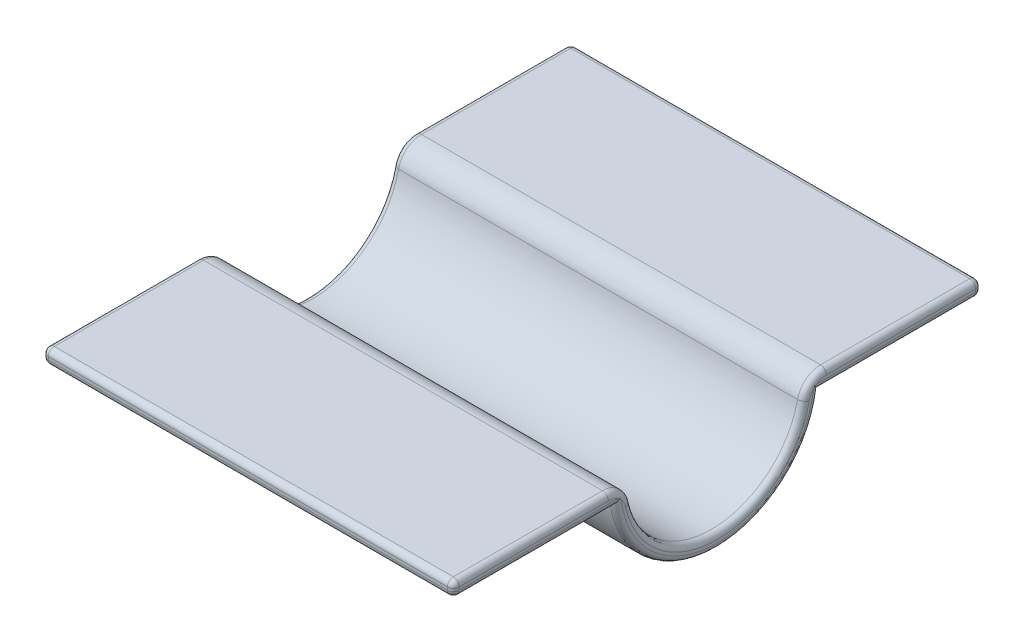
from build123d import *

# Parameters (mm, degrees)
BOSS_EXTRUDE1_DEPTH = 70
FILLET1_R           = 1
FILLET2_R           = 4
FILLET3_R           = 1


with BuildPart() as part:
    # Sketch1 → Boss-Extrude1 (new body)
    with BuildSketch(Plane(origin=(0, 0, 0), x_dir=(0, 0, -1), z_dir=(1, 0, 0))):
        with BuildLine():
            Line((-45, 0), (-15, 0))
            ThreePointArc((-15, 0), (0, -15), (15, 0))
            Line((15, 0), (45, 0))
            Line((45, 0), (45, -2.5))
            Line((45, -2.5), (17.320508076, -2.5))
            ThreePointArc((17.320508076, -2.5), (0, -17.5), (-17.320508076, -2.5))
            Line((-17.320508076, -2.5), (-45, -2.5))
            Line((-45, -2.5), (-45, 0))
        make_face()
    extrude(amount=BOSS_EXTRUDE1_DEPTH)

    # Fillet1
    fillet1_edges = [part.edges().sort_by_distance(p)[0] for p in [
        (35, 0, -45),
        (35, -2.5, -45),
        (35, -2.5, 45),
        (35, 0, 45),
    ]]
    fillet(fillet1_edges, radius=FILLET1_R)

    # Fillet2
    fillet2_edges = [part.edges().sort_by_distance(p)[0] for p in [
        (35, 0, -15),
        (35, 0, 15),
    ]]
    fillet(fillet2_edges, radius=FILLET2_R)

    # Fillet3
    # the kernel refuses this fillet: 1 mm, written as the material it takes off along each edge
    with BuildSketch(Plane(origin=(70, 0, 0), x_dir=(0, -0.0003007400627751114, -0.9999999547777063), z_dir=(0, 0.9999999547777063, -0.0003007400627751114))) as fillet3_piece_1_section:
        with BuildLine():
            CenterArc((17.5 - FILLET3_R, FILLET3_R), FILLET3_R, 270, 90)
            Line((17.5 - FILLET3_R, 0), (17.5, 0))
            Line((17.5, 0), (17.5, FILLET3_R))
        make_face()
    fillet3_piece_1 = revolve(axis=Axis((70, 0, 0), (-1, 0, 0)), revolution_arc=179.965537727, mode=Mode.PRIVATE)
    fillet3_piece_1 = split(fillet3_piece_1, bisect_by=Plane(origin=(70, -2.5, 0), z_dir=(0, -1, 0)), keep=Keep.TOP, mode=Mode.PRIVATE)
    add(fillet3_piece_1, mode=Mode.SUBTRACT)
    with BuildSketch(Plane(origin=(70, -2.5, -44), x_dir=(-1, 0, 0), z_dir=(0, 0, 1))) as fillet3_piece_2_section:
        with BuildLine():
            CenterArc((FILLET3_R, -FILLET3_R), FILLET3_R, 90, 90)
            Line((0, -FILLET3_R), (0, 0))
            Line((0, 0), (FILLET3_R, 0))
        make_face()
    fillet3_piece_2 = extrude(amount=29.179491924, mode=Mode.PRIVATE)
    fillet3_piece_2 = fillet3_piece_2 - Plane(origin=(70, 0, 0), x_dir=(0, -0.14285714285714307, -0.989743318610787), z_dir=(-1, 0, 0)) * Cylinder(17.5, 63, mode=Mode.PRIVATE)
    add(fillet3_piece_2, mode=Mode.SUBTRACT)
    with BuildSketch(Plane(origin=(0, -1, -45), x_dir=(0, 0, 1), z_dir=(0, -1, 0)), Plane(origin=(70, -1, -45), x_dir=(-1, 0, 0), z_dir=(0, -1, 0)), Plane(origin=(0, -1.5, 45), x_dir=(0, 0, -1), z_dir=(0, 1, 0)), Plane(origin=(70, -1.5, 45), x_dir=(-1, 0, 0), z_dir=(0, 1, 0))) as fillet3_piece_3:
        with BuildLine():
            CenterArc((FILLET3_R, -FILLET3_R), FILLET3_R, 90, 90)
            Line((0, -FILLET3_R), (0, 0))
            Line((0, 0), (FILLET3_R, 0))
        make_face()
    extrude(amount=0.5, mode=Mode.SUBTRACT)
    with BuildSketch(Plane(origin=(0, 0, -18.574175621), x_dir=(0, -1, 0), z_dir=(0, 0, -1)), Plane(origin=(70, 0, -18.574175621), x_dir=(-1, 0, 0), z_dir=(0, 0, -1)), Plane(origin=(0, 0, 44), x_dir=(0, -1, 0), z_dir=(0, 0, -1)), Plane(origin=(70, 0, 44), x_dir=(-1, 0, 0), z_dir=(0, 0, -1))) as fillet3_piece_4:
        with BuildLine():
            CenterArc((FILLET3_R, -FILLET3_R), FILLET3_R, 90, 90)
            Line((0, -FILLET3_R), (0, 0))
            Line((0, 0), (FILLET3_R, 0))
        make_face()
    extrude(amount=25.425824379, mode=Mode.SUBTRACT)
    with BuildSketch(Plane(origin=(0, -2.5, 14.820508076), x_dir=(0, 1, 0), z_dir=(0, 0, 1))) as fillet3_piece_5_section:
        with BuildLine():
            CenterArc((FILLET3_R, -FILLET3_R), FILLET3_R, 90, 90)
            Line((0, -FILLET3_R), (0, 0))
            Line((0, 0), (FILLET3_R, 0))
        make_face()
    fillet3_piece_5 = extrude(amount=29.179491924, mode=Mode.PRIVATE)
    fillet3_piece_5 = fillet3_piece_5 - Plane(origin=(0, 0, 0), x_dir=(0, -0.14285714285714307, -0.989743318610787), z_dir=(-1, 0, 0)) * Cylinder(17.5, 63, mode=Mode.PRIVATE)
    add(fillet3_piece_5, mode=Mode.SUBTRACT)
    with BuildSketch(Plane(origin=(0, -1, 44), x_dir=(0, 0, 1), z_dir=(0, -1, 0))) as fillet3_piece_6:
        with BuildLine():
            CenterArc((1 - FILLET3_R, -FILLET3_R), FILLET3_R, 0, 90)
            Line((1, -FILLET3_R), (1, 0))
            Line((1, 0), (1 - FILLET3_R, 0))
        make_face()
    revolve(axis=Axis((0, -1, 44), (-1, 0, 0)), revolution_arc=90, mode=Mode.SUBTRACT)
    with BuildSketch(Plane(origin=(0, -1.5, 44), x_dir=(0, -1, 0), z_dir=(0, 0, -1))) as fillet3_piece_7:
        with BuildLine():
            CenterArc((1 - FILLET3_R, -FILLET3_R), FILLET3_R, 0, 90)
            Line((1, -FILLET3_R), (1, 0))
            Line((1, 0), (1 - FILLET3_R, 0))
        make_face()
    revolve(axis=Axis((0, -1.5, 44), (-1, 0, 0)), revolution_arc=90, mode=Mode.SUBTRACT)
    with BuildSketch(Plane(origin=(0, -1, -44), x_dir=(0, 1, 0), z_dir=(0, 0, 1))) as fillet3_piece_8:
        with BuildLine():
            CenterArc((1 - FILLET3_R, -FILLET3_R), FILLET3_R, 0, 90)
            Line((1, -FILLET3_R), (1, 0))
            Line((1, 0), (1 - FILLET3_R, 0))
        make_face()
    revolve(axis=Axis((0, -1, -44), (-1, 0, 0)), revolution_arc=90, mode=Mode.SUBTRACT)
    with BuildSketch(Plane(origin=(0, -1.5, -44), x_dir=(0, 0, -1), z_dir=(0, 1, 0))) as fillet3_piece_9:
        with BuildLine():
            CenterArc((1 - FILLET3_R, -FILLET3_R), FILLET3_R, 0, 90)
            Line((1, -FILLET3_R), (1, 0))
            Line((1, 0), (1 - FILLET3_R, 0))
        make_face()
    revolve(axis=Axis((0, -1.5, -44), (-1, 0, 0)), revolution_arc=90, mode=Mode.SUBTRACT)
    with BuildSketch(Plane(origin=(70, -2.5, 14.820508076), x_dir=(-1, 0, 0), z_dir=(0, 0, 1))) as fillet3_piece_10_section:
        with BuildLine():
            CenterArc((FILLET3_R, -FILLET3_R), FILLET3_R, 90, 90)
            Line((0, -FILLET3_R), (0, 0))
            Line((0, 0), (FILLET3_R, 0))
        make_face()
    fillet3_piece_10 = extrude(amount=29.179491924, mode=Mode.PRIVATE)
    fillet3_piece_10 = fillet3_piece_10 - Plane(origin=(70, 0, 0), x_dir=(0, -0.14285714285714307, -0.989743318610787), z_dir=(-1, 0, 0)) * Cylinder(17.5, 63, mode=Mode.PRIVATE)
    add(fillet3_piece_10, mode=Mode.SUBTRACT)
    with BuildSketch(Plane(origin=(70, -1, 44), x_dir=(0, 0, 1), z_dir=(0, -1, 0))) as fillet3_piece_11:
        with BuildLine():
            CenterArc((1 - FILLET3_R, FILLET3_R), FILLET3_R, 270, 90)
            Line((1 - FILLET3_R, 0), (1, 0))
            Line((1, 0), (1, FILLET3_R))
        make_face()
    revolve(axis=Axis((70, -1, 44), (-1, 0, 0)), revolution_arc=90, mode=Mode.SUBTRACT)
    with BuildSketch(Plane(origin=(70, -1.5, 44), x_dir=(0, -1, 0), z_dir=(0, 0, -1))) as fillet3_piece_12:
        with BuildLine():
            CenterArc((1 - FILLET3_R, FILLET3_R), FILLET3_R, 270, 90)
            Line((1 - FILLET3_R, 0), (1, 0))
            Line((1, 0), (1, FILLET3_R))
        make_face()
    revolve(axis=Axis((70, -1.5, 44), (-1, 0, 0)), revolution_arc=90, mode=Mode.SUBTRACT)
    with BuildSketch(Plane(origin=(70, -1, -44), x_dir=(0, 1, 0), z_dir=(0, 0, 1))) as fillet3_piece_13:
        with BuildLine():
            CenterArc((1 - FILLET3_R, FILLET3_R), FILLET3_R, 270, 90)
            Line((1 - FILLET3_R, 0), (1, 0))
            Line((1, 0), (1, FILLET3_R))
        make_face()
    revolve(axis=Axis((70, -1, -44), (-1, 0, 0)), revolution_arc=90, mode=Mode.SUBTRACT)
    with BuildSketch(Plane(origin=(70, -1.5, -44), x_dir=(0, 0, -1), z_dir=(0, 1, 0))) as fillet3_piece_14:
        with BuildLine():
            CenterArc((1 - FILLET3_R, FILLET3_R), FILLET3_R, 270, 90)
            Line((1 - FILLET3_R, 0), (1, 0))
            Line((1, 0), (1, FILLET3_R))
        make_face()
    revolve(axis=Axis((70, -1.5, -44), (-1, 0, 0)), revolution_arc=90, mode=Mode.SUBTRACT)
    with BuildSketch(Plane(origin=(0, 0, 0), x_dir=(0, -0.21052631578947376, 0.9775881905793005), z_dir=(0, 0.9775881905793005, 0.21052631578947376))) as fillet3_piece_15:
        with BuildLine():
            CenterArc((15 + FILLET3_R, FILLET3_R), FILLET3_R, 180, 90)
            Line((15, FILLET3_R), (15, 0))
            Line((15, 0), (15 + FILLET3_R, 0))
        make_face()
    revolve(axis=Axis((0, 0, 0), (1, 0, 0)), revolution_arc=155.693605062, mode=Mode.SUBTRACT)
    with BuildSketch(Plane(origin=(70, 0, 0), x_dir=(0, -0.21052631578947376, 0.9775881905793005), z_dir=(0, 0.9775881905793005, 0.21052631578947376))) as fillet3_piece_16:
        with BuildLine():
            CenterArc((15 + FILLET3_R, -FILLET3_R), FILLET3_R, 90, 90)
            Line((15 + FILLET3_R, 0), (15, 0))
            Line((15, 0), (15, -FILLET3_R))
        make_face()
    revolve(axis=Axis((70, 0, 0), (1, 0, 0)), revolution_arc=155.693605062, mode=Mode.SUBTRACT)
    with BuildSketch(Plane(origin=(0, -4, 18.574175621), x_dir=(0, 1, 0), z_dir=(0, 0, 1))) as fillet3_piece_17:
        with BuildLine():
            CenterArc((4 - FILLET3_R, -FILLET3_R), FILLET3_R, 0, 90)
            Line((4, -FILLET3_R), (4, 0))
            Line((4, 0), (4 - FILLET3_R, 0))
        make_face()
    revolve(axis=Axis((0, -4, 18.574175621), (-1, 0, 0)), revolution_arc=77.846802531, mode=Mode.SUBTRACT)
    with BuildSketch(Plane(origin=(0, -4, -18.574175621), x_dir=(0, 0.21052631578947345, 0.9775881905793007), z_dir=(0, -0.9775881905793007, 0.21052631578947345))) as fillet3_piece_18:
        with BuildLine():
            CenterArc((4 - FILLET3_R, -FILLET3_R), FILLET3_R, 0, 90)
            Line((4, -FILLET3_R), (4, 0))
            Line((4, 0), (4 - FILLET3_R, 0))
        make_face()
    revolve(axis=Axis((0, -4, -18.574175621), (-1, 0, 0)), revolution_arc=77.846802531, mode=Mode.SUBTRACT)
    with BuildSketch(Plane(origin=(70, -4, 18.574175621), x_dir=(0, 1, 0), z_dir=(0, 0, 1))) as fillet3_piece_19:
        with BuildLine():
            CenterArc((4 - FILLET3_R, FILLET3_R), FILLET3_R, 270, 90)
            Line((4 - FILLET3_R, 0), (4, 0))
            Line((4, 0), (4, FILLET3_R))
        make_face()
    revolve(axis=Axis((70, -4, 18.574175621), (-1, 0, 0)), revolution_arc=77.846802531, mode=Mode.SUBTRACT)
    with BuildSketch(Plane(origin=(70, -4, -18.574175621), x_dir=(0, 0.21052631578947345, 0.9775881905793007), z_dir=(0, -0.9775881905793007, 0.21052631578947345))) as fillet3_piece_20:
        with BuildLine():
            CenterArc((4 - FILLET3_R, FILLET3_R), FILLET3_R, 270, 90)
            Line((4 - FILLET3_R, 0), (4, 0))
            Line((4, 0), (4, FILLET3_R))
        make_face()
    revolve(axis=Axis((70, -4, -18.574175621), (-1, 0, 0)), revolution_arc=77.846802531, mode=Mode.SUBTRACT)
    with BuildSketch(Plane(origin=(0, -2.5, -44), x_dir=(0, 1, 0), z_dir=(0, 0, 1))) as fillet3_piece_21_section:
        with BuildLine():
            CenterArc((FILLET3_R, -FILLET3_R), FILLET3_R, 90, 90)
            Line((0, -FILLET3_R), (0, 0))
            Line((0, 0), (FILLET3_R, 0))
        make_face()
    fillet3_piece_21 = extrude(amount=29.179491924, mode=Mode.PRIVATE)
    fillet3_piece_21 = fillet3_piece_21 - Plane(origin=(0, 0, 0), x_dir=(0, -0.14285714285714307, -0.989743318610787), z_dir=(-1, 0, 0)) * Cylinder(17.5, 63, mode=Mode.PRIVATE)
    add(fillet3_piece_21, mode=Mode.SUBTRACT)
    with BuildSketch(Plane(origin=(0, 0, 0), x_dir=(0, -0.0003007400627751114, -0.9999999547777063), z_dir=(0, 0.9999999547777063, -0.0003007400627751114))) as fillet3_piece_22_section:
        with BuildLine():
            CenterArc((17.5 - FILLET3_R, -FILLET3_R), FILLET3_R, 0, 90)
            Line((17.5, -FILLET3_R), (17.5, 0))
            Line((17.5, 0), (17.5 - FILLET3_R, 0))
        make_face()
    fillet3_piece_22 = revolve(axis=Axis((0, 0, 0), (-1, 0, 0)), revolution_arc=179.965537727, mode=Mode.PRIVATE)
    fillet3_piece_22 = split(fillet3_piece_22, bisect_by=Plane(origin=(0, -2.5, 0), z_dir=(0, -1, 0)), keep=Keep.TOP, mode=Mode.PRIVATE)
    add(fillet3_piece_22, mode=Mode.SUBTRACT)
    with BuildSketch(Plane(origin=(70, 0, 0), x_dir=(0, -0.0003007400627751114, -0.9999999547777063), z_dir=(0, 0.9999999547777063, -0.0003007400627751114))) as fillet3_piece_23a_section:
        with BuildLine():
            CenterArc((17.5 - FILLET3_R, FILLET3_R), FILLET3_R, 270, 90)
            Line((17.5 - FILLET3_R, 0), (17.5, 0))
            Line((17.5, 0), (17.5, FILLET3_R))
        make_face()
    fillet3_piece_23a = revolve(axis=Axis((70, 0, 0), (-1, 0, 0)), revolution_arc=179.965537727, mode=Mode.PRIVATE)
    fillet3_piece_23a = fillet3_piece_23a & Plane(origin=(70, -4, -18.574175621), x_dir=(0, 0.21052631578947353, 0.9775881905793006), z_dir=(1, 0, 0)) * Cylinder(4, 70, mode=Mode.PRIVATE)
    fillet3_piece_23a = split(fillet3_piece_23a, bisect_by=Plane(origin=(70, -2.5, 0), z_dir=(0, 1, 0)), keep=Keep.TOP, mode=Mode.PRIVATE)
    with BuildSketch(Plane(origin=(70, -2.5, -44), x_dir=(-1, 0, 0), z_dir=(0, 0, 1))) as fillet3_piece_23b_section:
        with BuildLine():
            CenterArc((FILLET3_R, -FILLET3_R), FILLET3_R, 90, 90)
            Line((0, -FILLET3_R), (0, 0))
            Line((0, 0), (FILLET3_R, 0))
        make_face()
    fillet3_piece_23b = extrude(amount=29.179491924, mode=Mode.PRIVATE)
    fillet3_piece_23b = fillet3_piece_23b & Plane(origin=(70, -4, -18.574175621), x_dir=(0, 0.21052631578947353, 0.9775881905793006), z_dir=(1, 0, 0)) * Cylinder(4, 63, mode=Mode.PRIVATE)
    fillet3_piece_23b = fillet3_piece_23b & Plane(origin=(70, 0, 0), x_dir=(0, -0.14285714285714307, -0.989743318610787), z_dir=(-1, 0, 0)) * Cylinder(17.5, 63, mode=Mode.PRIVATE)
    fillet3_piece_23 = fillet3_piece_23a & fillet3_piece_23b
    add(fillet3_piece_23, mode=Mode.SUBTRACT)
    with BuildSketch(Plane(origin=(70, -2.5, 14.820508076), x_dir=(-1, 0, 0), z_dir=(0, 0, 1))) as fillet3_piece_24a_section:
        with BuildLine():
            CenterArc((FILLET3_R, -FILLET3_R), FILLET3_R, 90, 90)
            Line((0, -FILLET3_R), (0, 0))
            Line((0, 0), (FILLET3_R, 0))
        make_face()
    fillet3_piece_24a = extrude(amount=29.179491924, mode=Mode.PRIVATE)
    fillet3_piece_24a = fillet3_piece_24a & Plane(origin=(70, -4, 18.574175621), x_dir=(0, 1, 0), z_dir=(1, 0, 0)) * Cylinder(4, 63, mode=Mode.PRIVATE)
    fillet3_piece_24a = fillet3_piece_24a & Plane(origin=(70, 0, 0), x_dir=(0, -0.14285714285714307, -0.989743318610787), z_dir=(-1, 0, 0)) * Cylinder(17.5, 63, mode=Mode.PRIVATE)
    with BuildSketch(Plane(origin=(70, 0, 0), x_dir=(0, -0.0003007400627751114, -0.9999999547777063), z_dir=(0, 0.9999999547777063, -0.0003007400627751114))) as fillet3_piece_24b_section:
        with BuildLine():
            CenterArc((17.5 - FILLET3_R, FILLET3_R), FILLET3_R, 270, 90)
            Line((17.5 - FILLET3_R, 0), (17.5, 0))
            Line((17.5, 0), (17.5, FILLET3_R))
        make_face()
    fillet3_piece_24b = revolve(axis=Axis((70, 0, 0), (-1, 0, 0)), revolution_arc=179.965537727, mode=Mode.PRIVATE)
    fillet3_piece_24b = fillet3_piece_24b & Plane(origin=(70, -4, 18.574175621), x_dir=(0, 1, 0), z_dir=(1, 0, 0)) * Cylinder(4, 70, mode=Mode.PRIVATE)
    fillet3_piece_24b = split(fillet3_piece_24b, bisect_by=Plane(origin=(70, -2.5, 0), z_dir=(0, 1, 0)), keep=Keep.TOP, mode=Mode.PRIVATE)
    fillet3_piece_24 = fillet3_piece_24a & fillet3_piece_24b
    add(fillet3_piece_24, mode=Mode.SUBTRACT)
    with BuildSketch(Plane(origin=(0, -2.5, 14.820508076), x_dir=(0, 1, 0), z_dir=(0, 0, 1))) as fillet3_piece_25a_section:
        with BuildLine():
            CenterArc((FILLET3_R, -FILLET3_R), FILLET3_R, 90, 90)
            Line((0, -FILLET3_R), (0, 0))
            Line((0, 0), (FILLET3_R, 0))
        make_face()
    fillet3_piece_25a = extrude(amount=29.179491924, mode=Mode.PRIVATE)
    fillet3_piece_25a = fillet3_piece_25a & Plane(origin=(0, -4, 18.574175621), x_dir=(0, 1, 0), z_dir=(1, 0, 0)) * Cylinder(4, 63, mode=Mode.PRIVATE)
    fillet3_piece_25a = fillet3_piece_25a & Plane(origin=(0, 0, 0), x_dir=(0, -0.14285714285714307, -0.989743318610787), z_dir=(-1, 0, 0)) * Cylinder(17.5, 63, mode=Mode.PRIVATE)
    with BuildSketch(Plane(origin=(0, 0, 0), x_dir=(0, -0.0003007400627751114, -0.9999999547777063), z_dir=(0, 0.9999999547777063, -0.0003007400627751114))) as fillet3_piece_25b_section:
        with BuildLine():
            CenterArc((17.5 - FILLET3_R, -FILLET3_R), FILLET3_R, 0, 90)
            Line((17.5, -FILLET3_R), (17.5, 0))
            Line((17.5, 0), (17.5 - FILLET3_R, 0))
        make_face()
    fillet3_piece_25b = revolve(axis=Axis((0, 0, 0), (-1, 0, 0)), revolution_arc=179.965537727, mode=Mode.PRIVATE)
    fillet3_piece_25b = fillet3_piece_25b & Plane(origin=(0, -4, 18.574175621), x_dir=(0, 1, 0), z_dir=(1, 0, 0)) * Cylinder(4, 70, mode=Mode.PRIVATE)
    fillet3_piece_25b = split(fillet3_piece_25b, bisect_by=Plane(origin=(0, -2.5, 0), z_dir=(0, 1, 0)), keep=Keep.TOP, mode=Mode.PRIVATE)
    fillet3_piece_25 = fillet3_piece_25a & fillet3_piece_25b
    add(fillet3_piece_25, mode=Mode.SUBTRACT)
    with BuildSketch(Plane(origin=(0, 0, 0), x_dir=(0, -0.0003007400627751114, -0.9999999547777063), z_dir=(0, 0.9999999547777063, -0.0003007400627751114))) as fillet3_piece_26a_section:
        with BuildLine():
            CenterArc((17.5 - FILLET3_R, -FILLET3_R), FILLET3_R, 0, 90)
            Line((17.5, -FILLET3_R), (17.5, 0))
            Line((17.5, 0), (17.5 - FILLET3_R, 0))
        make_face()
    fillet3_piece_26a = revolve(axis=Axis((0, 0, 0), (-1, 0, 0)), revolution_arc=179.965537727, mode=Mode.PRIVATE)
    fillet3_piece_26a = fillet3_piece_26a & Plane(origin=(0, -4, -18.574175621), x_dir=(0, 0.21052631578947353, 0.9775881905793006), z_dir=(1, 0, 0)) * Cylinder(4, 70, mode=Mode.PRIVATE)
    fillet3_piece_26a = split(fillet3_piece_26a, bisect_by=Plane(origin=(0, -2.5, 0), z_dir=(0, 1, 0)), keep=Keep.TOP, mode=Mode.PRIVATE)
    with BuildSketch(Plane(origin=(0, -2.5, -44), x_dir=(0, 1, 0), z_dir=(0, 0, 1))) as fillet3_piece_26b_section:
        with BuildLine():
            CenterArc((FILLET3_R, -FILLET3_R), FILLET3_R, 90, 90)
            Line((0, -FILLET3_R), (0, 0))
            Line((0, 0), (FILLET3_R, 0))
        make_face()
    fillet3_piece_26b = extrude(amount=29.179491924, mode=Mode.PRIVATE)
    fillet3_piece_26b = fillet3_piece_26b & Plane(origin=(0, -4, -18.574175621), x_dir=(0, 0.21052631578947353, 0.9775881905793006), z_dir=(1, 0, 0)) * Cylinder(4, 63, mode=Mode.PRIVATE)
    fillet3_piece_26b = fillet3_piece_26b & Plane(origin=(0, 0, 0), x_dir=(0, -0.14285714285714307, -0.989743318610787), z_dir=(-1, 0, 0)) * Cylinder(17.5, 63, mode=Mode.PRIVATE)
    fillet3_piece_26 = fillet3_piece_26a & fillet3_piece_26b
    add(fillet3_piece_26, mode=Mode.SUBTRACT)


solid = part.part
